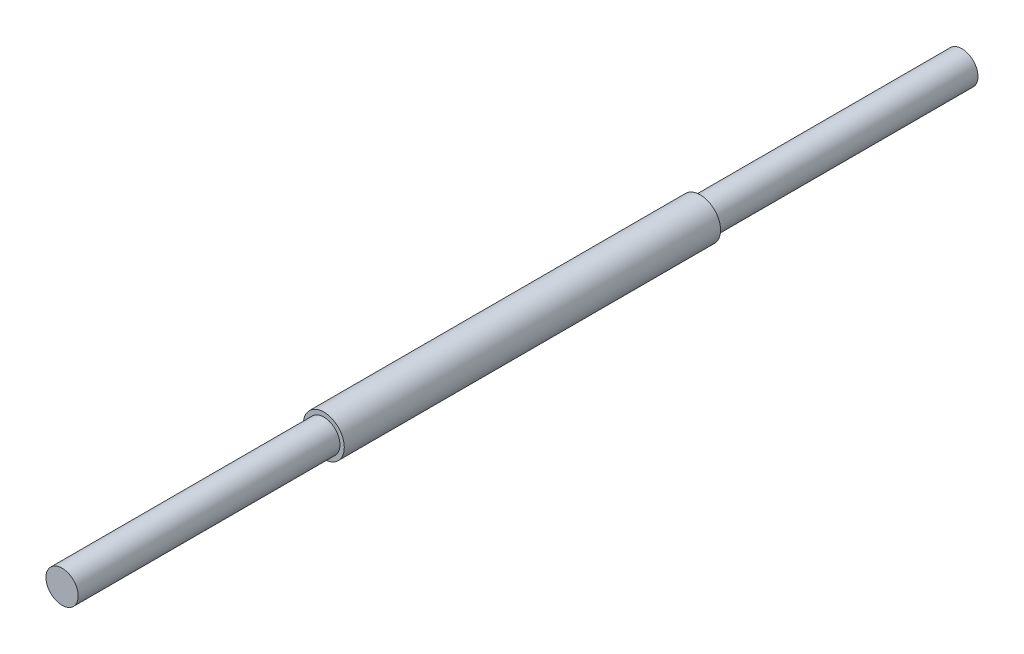
from build123d import *

# Parameters (mm, degrees)
BOSS_EXTRUDE1_DEPTH      = 69.85
BOSS_EXTRUDE1_DEPTH_BACK = 69.85
SKETCH2_R                = 2.5
BOSS_EXTRUDE2_DEPTH      = 29.21
BOSS_EXTRUDE2_DEPTH_BACK = 29.21
SKETCH3_R                = 3.175


with BuildPart() as part:
    # Sketch2 → Boss-Extrude1 (new, two sides: drawn at the far end of the back side and taken through both)
    with BuildSketch(Plane.XY.offset(-BOSS_EXTRUDE1_DEPTH_BACK)):
        Circle(SKETCH2_R)
    extrude(amount=BOSS_EXTRUDE1_DEPTH + BOSS_EXTRUDE1_DEPTH_BACK)

    # Sketch3 → Boss-Extrude2 (add, two sides: drawn at the far end of the back side and taken through both)
    with BuildSketch(Plane.XY.offset(-BOSS_EXTRUDE2_DEPTH_BACK)):
        Circle(SKETCH3_R)
    extrude(amount=BOSS_EXTRUDE2_DEPTH + BOSS_EXTRUDE2_DEPTH_BACK)


solid = part.part
